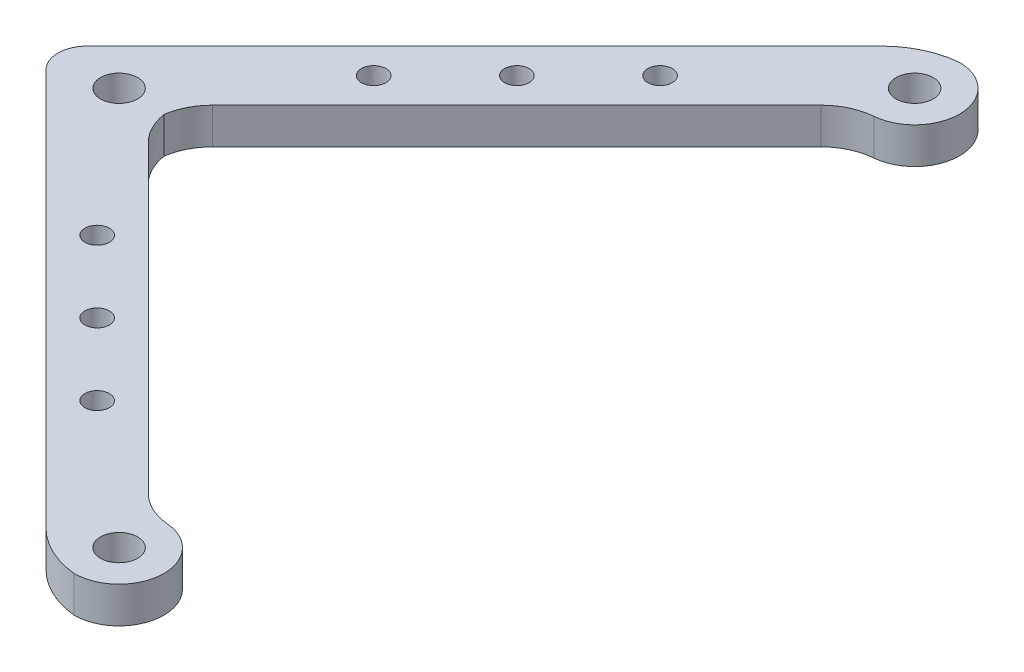
from build123d import *

# Parameters (mm, degrees)
BOSS_EXTRUDE2_DEPTH = 6.35
SKETCH6_R           = 7.874
BOSS_EXTRUDE3_DEPTH = 6.35
CIRPATTERN1_COUNT   = 3
CIRPATTERN1_ANGLE   = 180
SKETCH7_R           = 2.15265
CUT_EXTRUDE1_DEPTH  = 118.095768176
FILLET1_R           = 15.24
FILLET2_R           = 10.16
FILLET3_R           = 5.08


with BuildPart() as part:
    # Sketch1 → Boss-Extrude2 (new body)
    with BuildSketch(Plane(origin=(0, 0, 0), x_dir=(1, 0, 0), z_dir=(0, 1, 0))):
        Polygon((-82.677748493, 0), (0, -82.677), (0, -64.716569057), (-64.71715495, 0), align=None)
    boss_extrude2 = extrude(amount=BOSS_EXTRUDE2_DEPTH)

    # Mirror1: Boss-Extrude2 across plane
    add(boss_extrude2.mirror(Plane.XY))

    # Sketch6 → Boss-Extrude3 (add)
    with BuildSketch(Plane(origin=(0, 6.35, 0), x_dir=(1, 0, 0), z_dir=(0, 1, 0))):
        with Locations((0, -69.85)):
            Circle(SKETCH6_R)
    boss_extrude3 = extrude(amount=-BOSS_EXTRUDE3_DEPTH)

    # Sketch5 → F (0.257) Diameter Hole1 (revolve, cut)
    with BuildSketch(Plane(origin=(0, 6.35, 69.85), x_dir=(0, 0, 1), z_dir=(1, 0, 0))):
        Polygon((0, 0), (0, 52.761148974), (3.2639, 50.8), (3.2639, 0), align=None)
    f_0_257_diameter_hole1 = revolve(axis=Axis((0, 12.7, 69.85), (0, -1, 0)), mode=Mode.SUBTRACT)

    # CirPattern1: Boss-Extrude3, F (0.257) Diameter Hole1 ×3 about axis
    cirpattern1_axis = Axis((0, 0, 0), (0, -1, 0))
    add([boss_extrude3.rotate(cirpattern1_axis, i * CIRPATTERN1_ANGLE / (CIRPATTERN1_COUNT - 1)) for i in range(1, CIRPATTERN1_COUNT)])
    add([f_0_257_diameter_hole1.rotate(cirpattern1_axis, i * CIRPATTERN1_ANGLE / (CIRPATTERN1_COUNT - 1)) for i in range(1, CIRPATTERN1_COUNT)], mode=Mode.SUBTRACT)

    # Sketch7 → Cut-Extrude1 (cut, through all)
    with BuildSketch(Plane(origin=(0, 6.35, 0), x_dir=(1, 0, 0), z_dir=(0, 1, 0))):
        with Locations(Location((-36.848766511, -36.848351615, 0), (0, 0, 270))):
            Circle(SKETCH7_R)
        with Locations(Location((-49.42112508, -24.275993045, 0), (0, 0, 270))):
            Circle(SKETCH7_R)
        with Locations(Location((-24.276407941, -49.420710184, 0), (0, 0, 270))):
            Circle(SKETCH7_R)
    cut_extrude1 = extrude(amount=-CUT_EXTRUDE1_DEPTH, mode=Mode.SUBTRACT)

    # Mirror2: Cut-Extrude1 across plane
    add(cut_extrude1.mirror(Plane.XY), mode=Mode.SUBTRACT)

    # Fillet1
    # the kernel refuses this fillet: 15.24 mm, written as the material it takes off along each edge
    with BuildSketch(Plane(origin=(0, -33.056477591, 82.677), x_dir=(-0.7071099819596415, 0, -0.707103580398965), z_dir=(0, 1, 0))) as fillet1_piece_1:
        with BuildLine():
            CenterArc((13.222591036, -15.24), FILLET1_R, 90, 39.629113094)
            Line((3.502284034, -3.502315741), (0, 0))
            Line((0, 0), (13.222591036, 0))
        make_face()
    extrude(amount=72.462955182, mode=Mode.SUBTRACT)
    with BuildSketch(Plane(origin=(0, -33.056477591, -82.677), x_dir=(-0.7071099819596415, 0, 0.707103580398965), z_dir=(0, 1, 0))) as fillet1_piece_2:
        with BuildLine():
            CenterArc((13.222591036, 15.24), FILLET1_R, 230.370886906, 39.629113094)
            Line((3.502284034, 3.502315741), (0, 0))
            Line((0, 0), (13.222591036, 0))
        make_face()
    extrude(amount=72.462955182, mode=Mode.SUBTRACT)

    # Fillet2
    # the kernel refuses this fillet: 10.16 mm, written as the material it adds along each edge
    with BuildSketch(Plane(origin=(-62.342579148, 0, 2.374554305), x_dir=(0.11040173938387075, 0, -0.9938870438540871), z_dir=(0, 1, 0))) as fillet2_piece_1:
        with BuildLine():
            CenterArc((5.03816312, -9.966042895), FILLET2_R, 101.213390693, 40.125343256)
            Line((-2.895302495, -3.618939355), (0, 0))
            ThreePointArc((0, 0), (1.531206438, -0.150316757), (3.062412877, 0))
        make_face()
    extrude(amount=6.35)
    with BuildSketch(Plane(origin=(-62.342579148, 0, -2.374554305), x_dir=(0.7071099819596407, 0, -0.7071035803989658), z_dir=(0, 1, 0))) as fillet2_piece_2:
        with BuildLine():
            CenterArc((4.634597997, -10.16), FILLET2_R, 90, 40.125343256)
            ThreePointArc((-1.913135001, -2.391294021), (-0.839192223, -1.289552131), (0, 0))
            Line((0, 0), (4.634597997, 0))
        make_face()
    extrude(amount=6.35)
    with BuildSketch(Plane(origin=(-2.374141848, 0, -62.342448702), x_dir=(0.9938916997559154, 0, 0.11035981676451387), z_dir=(0, 1, 0))) as fillet2_piece_3:
        with BuildLine():
            CenterArc((5.037838868, -9.966068103), FILLET2_R, 101.212659653, 40.12313883)
            Line((-2.895301552, -3.618558112), (0, 0))
            ThreePointArc((0, 0), (1.531107891, -0.150297221), (3.062215783, 0))
        make_face()
    extrude(amount=6.35)
    with BuildSketch(Plane(origin=(-2.374141848, 0, 62.342448702), x_dir=(-0.7071099819596428, 0, -0.7071035803989636), z_dir=(0, 1, 0))) as fillet2_piece_4:
        with BuildLine():
            CenterArc((4.634299719, -10.16), FILLET2_R, 90, 40.12313883)
            ThreePointArc((-1.913134377, -2.391042106), (-0.839211976, -1.289419981), (0, 0))
            Line((0, 0), (4.634299719, 0))
        make_face()
    extrude(amount=6.35)

    # Fillet3
    fillet3_edges = [part.edges().sort_by_distance(p)[0] for p in [
        (-82.677748493, 3.175, 0),
    ]]
    fillet(fillet3_edges, radius=FILLET3_R)


solid = part.part
